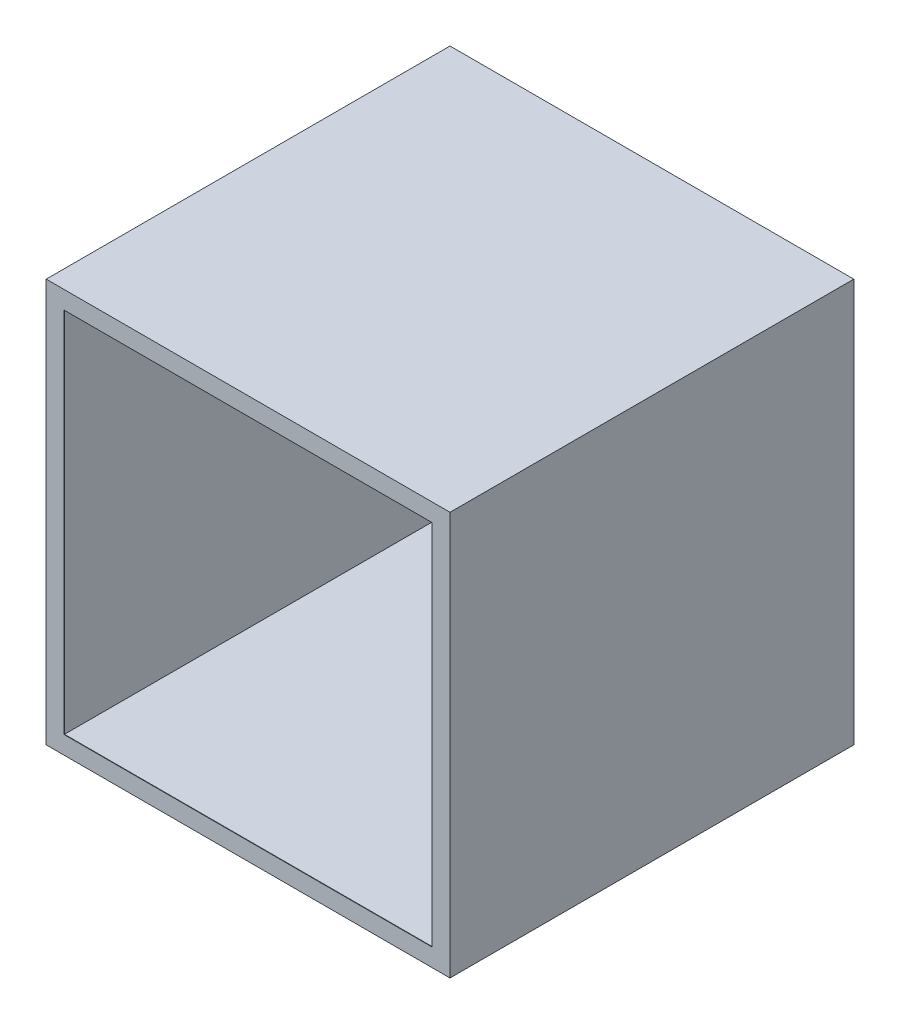
from build123d import *

# Parameters (mm, degrees)
SKETCH1_W           = 2600
SKETCH1_H           = 2600
BOSS_EXTRUDE1_DEPTH = 2597
SHELL1_T            = -3
SKETCH3_W           = 2600
SKETCH3_H           = 2597
SKETCH3_W_2         = 2370
SKETCH3_H_2         = 2367
BOSS_EXTRUDE2_DEPTH = 3


with BuildPart() as part:
    # Sketch1 → Boss-Extrude1 (new body)
    with BuildSketch(Plane(origin=(0, 0, 0), x_dir=(1, 0, 0), z_dir=(0, 1, 0))):
        Rectangle(SKETCH1_W, SKETCH1_H)
    extrude(amount=BOSS_EXTRUDE1_DEPTH)

    # Shell1
    shell1_openings = [part.faces().sort_by_distance(p)[0] for p in [
        (0, 1298.5, 1300),
    ]]
    offset(amount=SHELL1_T, openings=shell1_openings, kind=Kind.INTERSECTION)

    # Sketch3 → Boss-Extrude2 (add)
    with BuildSketch(Plane.XY.offset(1300)):
        with Locations((0, 1298.5)):
            Rectangle(SKETCH3_W, SKETCH3_H)
        with Locations((0, 1298.5)):
            Rectangle(SKETCH3_W_2, SKETCH3_H_2, mode=Mode.SUBTRACT)
    extrude(amount=-BOSS_EXTRUDE2_DEPTH)


solid = part.part
